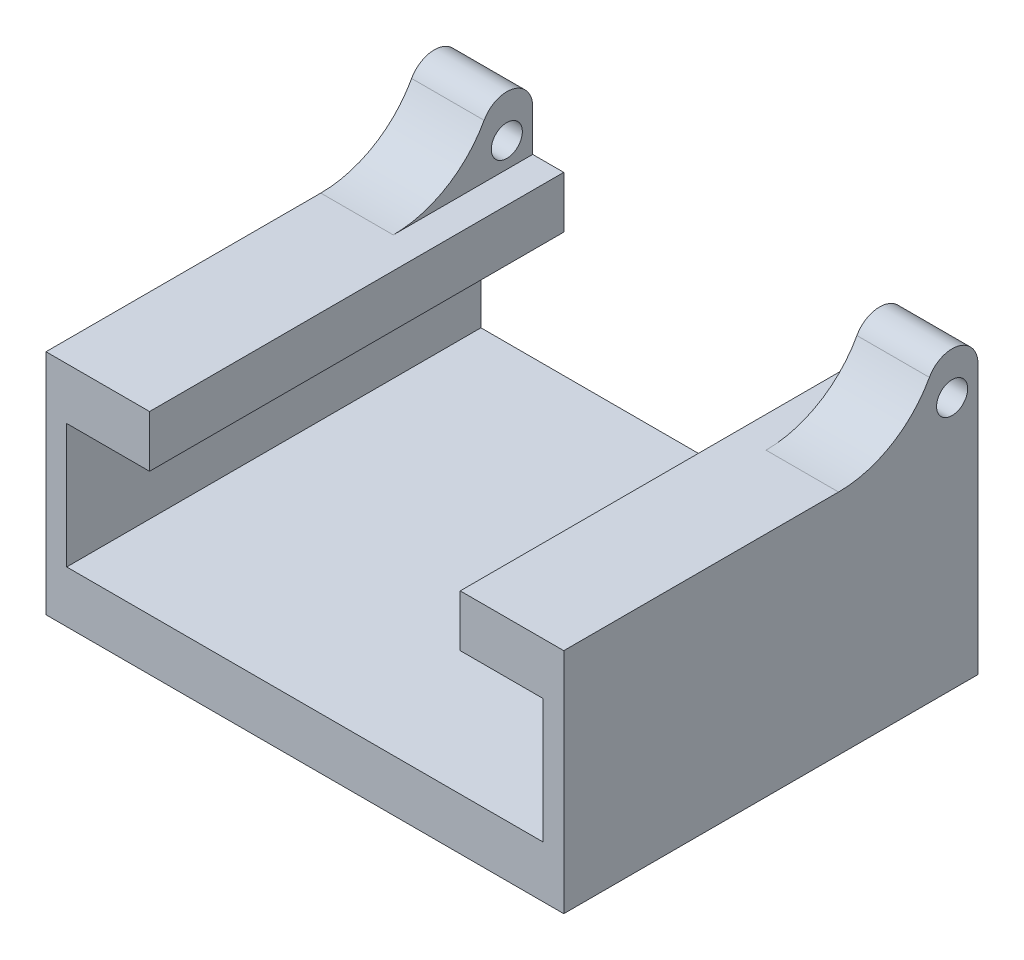
from build123d import *

# Parameters (mm, degrees)
SKETCH1_W           = 50
SKETCH1_H           = 40
BOSS_EXTRUDE2_DEPTH = 5
SKETCH2_W           = 2
SKETCH2_H           = 40
BOSS_EXTRUDE4_DEPTH = 12
SKETCH3_W           = 10
SKETCH3_H           = 40
BOSS_EXTRUDE5_DEPTH = 5
SKETCH5_R           = 1.5
BOSS_EXTRUDE6_DEPTH = 7
FILLET1_R           = 10
BOSS_EXTRUDE7_START = -7
SKETCH6_R           = 1.5
BOSS_EXTRUDE7_DEPTH = 7
FILLET2_R           = 10


with BuildPart() as part:
    # Sketch1 → Boss-Extrude2 (new body)
    with BuildSketch(Plane(origin=(0, 0, 0), x_dir=(1, 0, 0), z_dir=(0, 1, 0))):
        with Locations((25, 20)):
            Rectangle(SKETCH1_W, SKETCH1_H)
    extrude(amount=BOSS_EXTRUDE2_DEPTH)

    # Sketch2 → Boss-Extrude4 (add)
    with BuildSketch(Plane(origin=(0, 5, 0), x_dir=(1, 0, 0), z_dir=(0, 1, 0))):
        with Locations((1, 20)):
            Rectangle(SKETCH2_W, SKETCH2_H)
        with Locations((49, 20)):
            Rectangle(SKETCH2_W, SKETCH2_H)
    extrude(amount=BOSS_EXTRUDE4_DEPTH)

    # Sketch3 → Boss-Extrude5 (add)
    with BuildSketch(Plane(origin=(0, 17, 0), x_dir=(1, 0, 0), z_dir=(0, 1, 0))):
        with Locations((5, 20)):
            Rectangle(SKETCH3_W, SKETCH3_H)
        with Locations((45, 20)):
            Rectangle(SKETCH3_W, SKETCH3_H)
    extrude(amount=BOSS_EXTRUDE5_DEPTH)

    # Sketch5 → Boss-Extrude6 (add)
    with BuildSketch(Plane.ZY):
        with BuildLine():
            Line((-40, 22), (-35, 22))
            Line((-35, 22), (-35, 26))
            ThreePointArc((-35, 26), (-37.5, 28.5), (-40, 26))
            Line((-40, 26), (-40, 22))
        make_face()
        with Locations((-37.5, 24.41459259)):
            Circle(SKETCH5_R, mode=Mode.SUBTRACT)
    extrude(amount=-BOSS_EXTRUDE6_DEPTH)

    # Fillet1
    # the kernel refuses this fillet: 10 mm, written as the material it adds along each edge
    with BuildSketch(Plane(origin=(0, 22, -35), x_dir=(0, 0.99826370600864, -0.058903083670516616), z_dir=(1, 0, 0))) as fillet1_piece_1:
        with BuildLine():
            CenterArc((9.48397203, 9.040187721), FILLET1_R, 183.376852724, 61.314597986)
            Line((-0.49866503, 8.451156885), (-1.496928736, 8.392253801))
            Line((-1.496928736, 8.392253801), (-0.998263706, -0.058903084))
            Line((-0.998263706, -0.058903084), (0.058903084, -0.998263706))
            ThreePointArc((0.058903084, -0.998263706), (4.051957908, -0.762651371), (4.781551673, -0.904018772))
            Line((4.781551673, -0.904018772), (5.209044433, 0))
        make_face()
    extrude(amount=7)

    # Sketch6 → Boss-Extrude7 (add)
    with BuildSketch(Plane(origin=(50, 0, 0), x_dir=(0, 0, -1), z_dir=(1, 0, 0)).offset(BOSS_EXTRUDE7_START)):
        with BuildLine():
            Line((35, 22), (40, 22))
            Line((40, 22), (40, 26))
            ThreePointArc((40, 26), (37.5, 28.5), (35, 26))
            Line((35, 26), (35, 22))
        make_face()
        with Locations(Location((37.5, 24.41459259, 0), (0, 0, 180))):
            Circle(SKETCH6_R, mode=Mode.SUBTRACT)
    extrude(amount=BOSS_EXTRUDE7_DEPTH)

    # Fillet2
    # the kernel refuses this fillet: 10 mm, written as the material it adds along each edge
    with BuildSketch(Plane(origin=(43, 22, -35), x_dir=(0, 0, 1), z_dir=(1, 0, 0))) as fillet2_piece_1:
        with BuildLine():
            CenterArc((8.4658561, -10), FILLET2_R, 90, 61.314597986)
            Line((-0.30682878, -5.2), (-1.184097268, -4.72))
            ThreePointArc((-1.184097268, -4.72), (-1, -4), (-1, 0))
            Line((-1, 0), (0, 1))
            Line((0, 1), (8.4658561, 1))
            Line((8.4658561, 1), (8.4658561, 0))
        make_face()
    extrude(amount=7)


solid = part.part
